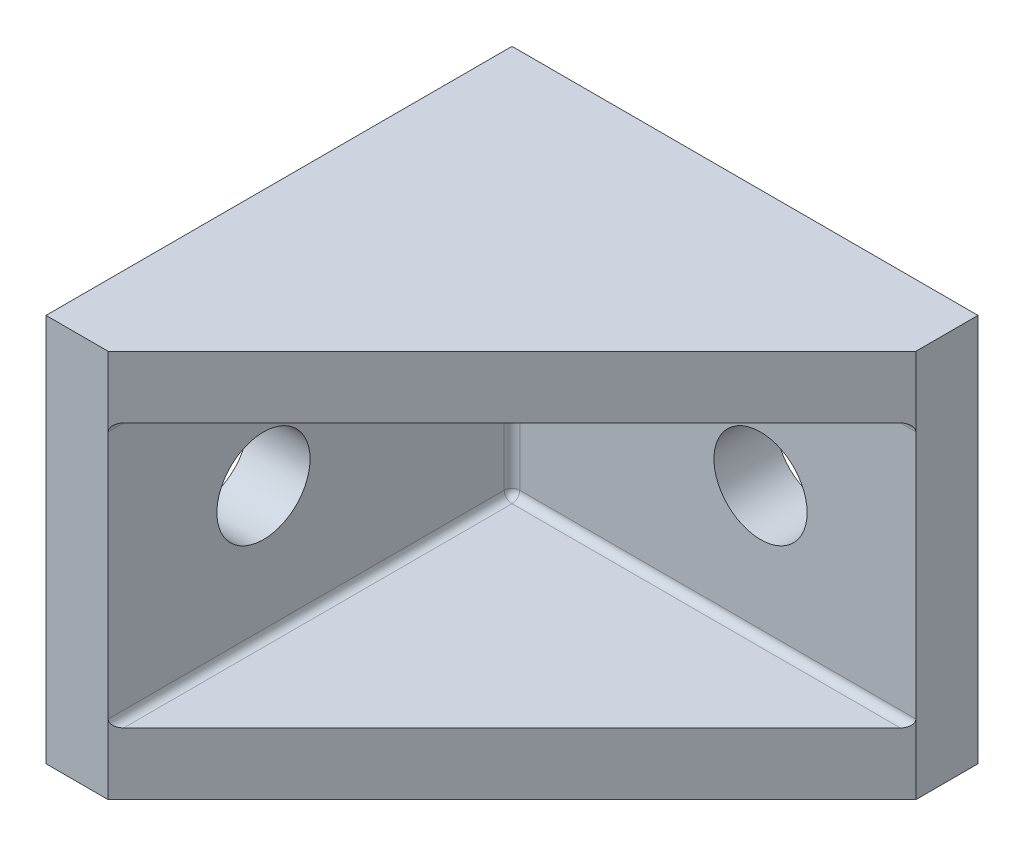
from build123d import *

# Parameters (mm, degrees)
DODANIE_WYCI_GNI_CIE1_DEPTH = 12.5
SKORUPA1_START              = 4
SKORUPA1_OUTLINE_W          = 27
SKORUPA1_OUTLINE_H          = 17
SKORUPA1_DEPTH              = 26
SZKIC2_R                    = 3
WYTNIJ_WYCI_GNI_CIE1_DEPTH  = 50
SZKIC3_R                    = 3
SZKIC3_R_2                  = 4
WYTNIJ_WYCI_GNI_CIE2_DEPTH  = 50
ZAOKR_GLENIE1_R             = 0.5


# Read off the part's stored shape, not the designer's step: Skorupa1
with BuildPart() as part:
    # Szkic1 → Dodanie-wyciągnięcie1 (new, symmetric)
    with BuildSketch(Plane(origin=(0, 0, 0), x_dir=(1, 0, 0), z_dir=(0, 1, 0))):
        Polygon((0, 0), (0, -30), (4, -30), (30, -4), (30, 0), align=None)
    extrude(amount=DODANIE_WYCI_GNI_CIE1_DEPTH, both=True)

    # Skorupa1 outline → Skorupa1 (cut)
    with BuildSketch(Plane.XY.offset(SKORUPA1_START)):
        with Locations((17.5, 0)):
            Rectangle(SKORUPA1_OUTLINE_W, SKORUPA1_OUTLINE_H)
    extrude(amount=SKORUPA1_DEPTH, mode=Mode.SUBTRACT)

    # Szkic2 → Wytnij-wyciągnięcie1 (cut)
    with BuildSketch(Plane(origin=(4, 0, 0), x_dir=(0, 0, -1), z_dir=(1, 0, 0))):
        with Locations((-20, 0)):
            Circle(SZKIC2_R)
    extrude(amount=-WYTNIJ_WYCI_GNI_CIE1_DEPTH, mode=Mode.SUBTRACT)

    # Szkic3 → Wytnij-wyciągnięcie2 (cut)
    with BuildSketch(Plane.XY.offset(4)):
        with Locations((20, 0)):
            Circle(SZKIC3_R)
        with Locations((18, 24.919871589)):
            Circle(SZKIC3_R_2)
    extrude(amount=-WYTNIJ_WYCI_GNI_CIE2_DEPTH, mode=Mode.SUBTRACT)

    # Zaokrąglenie1
    zaokr_glenie1_edges = [part.edges().sort_by_distance(p)[0] for p in [
        (17, -8.5, 4),
        (4, -8.5, 17),
        (4, 0, 4),
        (17, 8.5, 4),
        (4, 8.5, 17),
    ]]
    fillet(zaokr_glenie1_edges, radius=ZAOKR_GLENIE1_R)


solid = part.part
